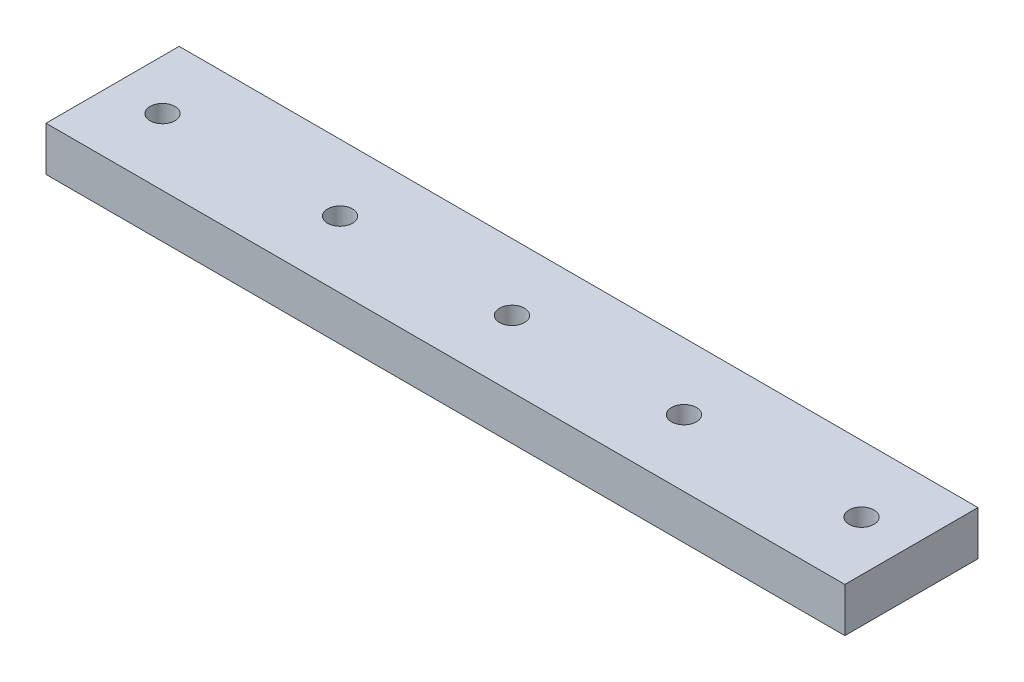
from build123d import *

# Parameters (mm, degrees)
SKETCH1_W           = 228.6
SKETCH1_H           = 38.1
SKETCH1_R           = 3.571875
BOSS_EXTRUDE1_DEPTH = 12.7


with BuildPart() as part:
    # Sketch1 → Boss-Extrude1 (new body)
    with BuildSketch(Plane(origin=(0, 0, 0), x_dir=(1, 0, 0), z_dir=(0, 1, 0))):
        with Locations((114.3, -19.05)):
            Rectangle(SKETCH1_W, SKETCH1_H)
        with Locations((14.2875, -19.05)):
            Circle(SKETCH1_R, mode=Mode.SUBTRACT)
        with Locations((65.0875, -19.05)):
            Circle(SKETCH1_R, mode=Mode.SUBTRACT)
        with Locations((114.3, -19.05)):
            Circle(SKETCH1_R, mode=Mode.SUBTRACT)
        with Locations((163.5125, -19.05)):
            Circle(SKETCH1_R, mode=Mode.SUBTRACT)
        with Locations((214.3125, -19.05)):
            Circle(SKETCH1_R, mode=Mode.SUBTRACT)
    extrude(amount=BOSS_EXTRUDE1_DEPTH)


solid = part.part
